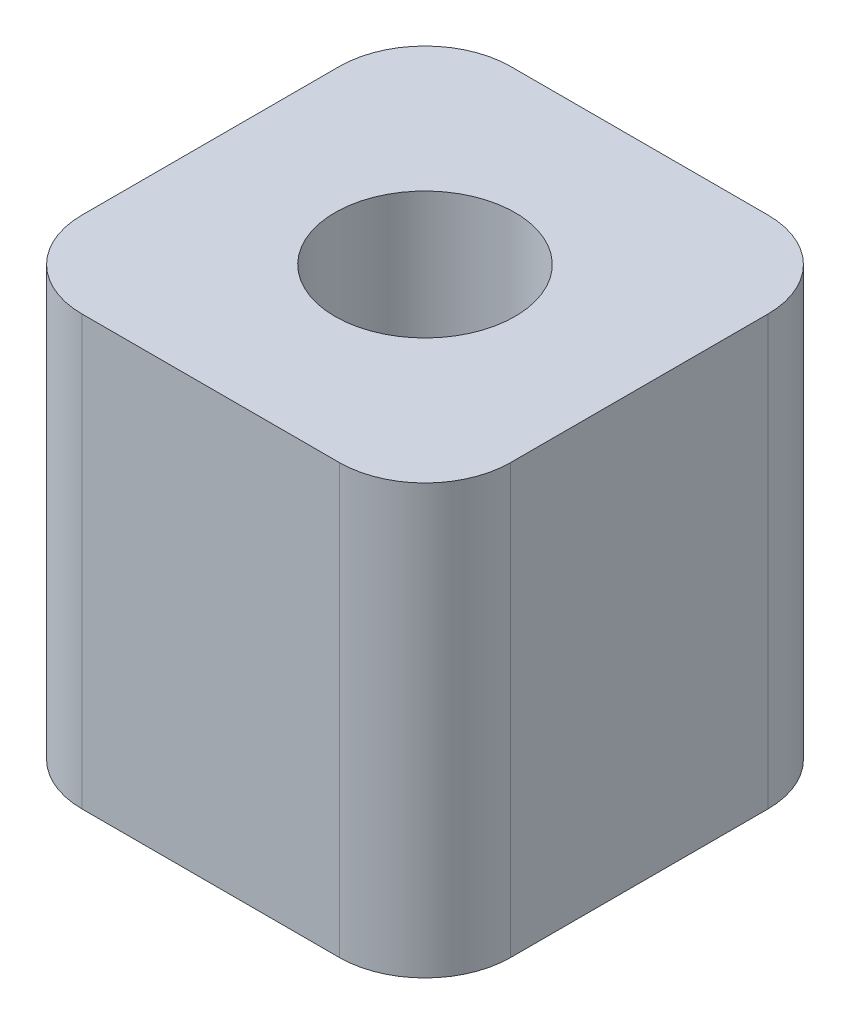
from build123d import *

# Parameters (mm, degrees)
SKETCH1_W           = 10
SKETCH1_H           = 10
SKETCH1_R           = 2.1
BOSS_EXTRUDE1_DEPTH = 10
FILLET1_R           = 2


with BuildPart() as part:
    # Sketch1 → Boss-Extrude1 (new body)
    with BuildSketch(Plane(origin=(0, 0, 0), x_dir=(1, 0, 0), z_dir=(0, 1, 0))):
        Rectangle(SKETCH1_W, SKETCH1_H)
        Circle(SKETCH1_R, mode=Mode.SUBTRACT)
    extrude(amount=BOSS_EXTRUDE1_DEPTH)

    # Fillet1
    fillet1_edges = [part.edges().sort_by_distance(p)[0] for p in [
        (-5, 5, 5),
        (-5, 5, -5),
        (5, 5, -5),
        (5, 5, 5),
    ]]
    fillet(fillet1_edges, radius=FILLET1_R)


solid = part.part
